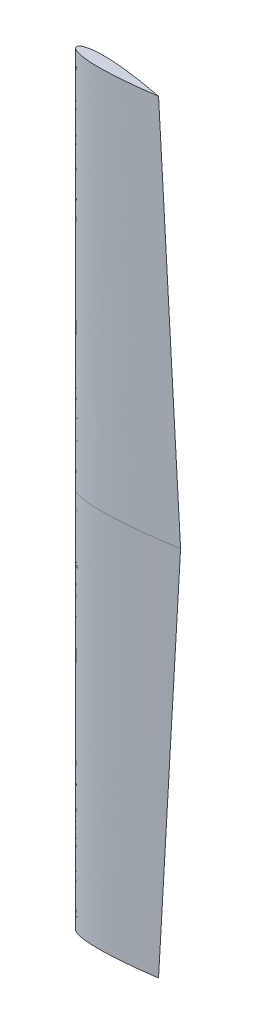
from build123d import *


with BuildPart() as part:
    # rootSketch → Loft1 section 0
    with BuildSketch(Plane(origin=(0, 0, 0), x_dir=(1, 0, 0), z_dir=(0, 1, 0))):
        with BuildLine():
            add(Edge.make_bspline(
                [(0, 0), (-2.2143e-05, 0.059910457), (0.005689744, 0.156769494), (0.027513467, 0.29567475), (0.081753505, 0.475775863), (0.154226641, 0.642768166), (0.260374744, 0.824845427), (0.411608789, 1.025675261), (0.629736848, 1.254056111), (0.953213109, 1.522004149), (1.442954854, 1.840410686), (2.189664226, 2.214679298), (3.347105975, 2.649726987), (5.078340765, 3.112876269), (7.664349596, 3.56751884), (11.004997338, 3.880915972), (14.906922914, 3.999519683), (19.16095578, 3.921267268), (22.876052412, 3.721841247), (26.058363999, 3.479391527), (29.231823055, 3.190656997), (31.8813319, 2.913364131), (34.512004858, 2.609280757), (37.691170775, 2.207437926), (40.823877361, 1.783828111), (44.029795465, 1.310113157), (47.107801011, 0.825131031), (49.834400512, 0.364783807), (51.733296144, 0.034944883), (53.577876917, -0.30582466), (54.525084917, -0.484720093), (55, -0.575979708)],
                knots=[0, 0, 0, 0, 0, 0.00384382, 0.006241333, 0.009008344, 0.012070374, 0.015524345, 0.019765532, 0.025140987, 0.032336865, 0.042479637, 0.057256916, 0.078755308, 0.111733691, 0.157569449, 0.225947504, 0.29432556, 0.362703619, 0.431081679, 0.46527071, 0.499459741, 0.5678378, 0.602026832, 0.636215863, 0.704593921, 0.772971981, 0.807161011, 0.841350041, 0.875539073, 0.909728105, 0.909728105, 0.909728105, 0.909728105, 0.909728105], degree=4))
            add(Edge.make_bspline(
                [(0, 0), (-0.001276808, -0.059896854), (0.002405364, -0.156854269), (0.021315288, -0.296186102), (0.071771677, -0.477383633), (0.140731696, -0.645857075), (0.243043381, -0.830117402), (0.390038394, -1.034070398), (0.603335767, -1.266969289), (0.921129604, -1.541632938), (1.404095737, -1.87022602), (2.142803252, -2.260050449), (3.290880204, -2.719242356), (5.01203584, -3.218546308), (7.5879562, -3.727246451), (10.921307989, -4.110536098), (14.819893959, -4.310829561), (19.07463264, -4.32168405), (22.793090953, -4.200104881), (25.979782091, -4.024353639), (29.158591955, -3.802142346), (31.813326903, -3.580397422), (34.449791151, -3.331473396), (37.636675387, -2.996298122), (40.777566333, -2.638387669), (43.992702063, -2.231916292), (47.080189251, -1.811501415), (49.815831549, -1.408356744), (51.721218347, -1.118357629), (53.572531112, -0.816292807), (54.523277876, -0.657273437), (55, -0.575979708)],
                knots=[0, 0, 0, 0, 0, 0.00384382, 0.006241333, 0.009008344, 0.012070374, 0.015524345, 0.019765532, 0.025140987, 0.032336865, 0.042479637, 0.057256916, 0.078755308, 0.111733691, 0.157569449, 0.225947504, 0.29432556, 0.362703619, 0.431081679, 0.46527071, 0.499459741, 0.5678378, 0.602026832, 0.636215863, 0.704593921, 0.772971981, 0.807161011, 0.841350041, 0.875539073, 0.909728105, 0.909728105, 0.909728105, 0.909728105, 0.909728105], degree=4))
        make_face()
    # tipSketch → Loft1 section 1
    with BuildSketch(Plane(origin=(0, 199.9998, 0), x_dir=(1, 0, 0), z_dir=(0, 1, 0))):
        with BuildLine():
            add(Edge.make_bspline(
                [(0, 0), (-2.291e-05, 0.047985884), (0.004564628, 0.125575864), (0.022128746, 0.236951514), (0.065785663, 0.380736989), (0.124150757, 0.513939064), (0.209320837, 0.658302875), (0.329893352, 0.816315878), (0.502752845, 0.994669279), (0.757200925, 1.202241218), (1.144764494, 1.449976653), (1.737475646, 1.740118052), (2.657425069, 2.074372794), (4.038727338, 2.42585814), (6.106215676, 2.761386439), (8.780217749, 2.974789916), (11.907352867, 3.025081267), (15.317259687, 2.912886911), (18.71871004, 2.680653361), (21.691190062, 2.397355858), (24.229922357, 2.111391584), (26.772523087, 1.793609975), (28.875002701, 1.508658782), (31.000579644, 1.197995109), (33.082675643, 0.876676335), (34.804807169, 0.596414356), (36.831233153, 0.25783157), (39.067254194, -0.143561881), (40.942231342, -0.490726471), (42.865619917, -0.873948149), (43.620346005, -1.027551369), (44, -1.106073509)],
                knots=[0, 0, 0, 0, 0, 0.003845658, 0.006245277, 0.009022611, 0.012044555, 0.015501019, 0.019679599, 0.024953702, 0.03195376, 0.041823539, 0.056555515, 0.077861291, 0.110456483, 0.156156733, 0.224644526, 0.293132328, 0.361620133, 0.43010794, 0.498595745, 0.532839648, 0.567083551, 0.635571356, 0.669815259, 0.704059162, 0.738303064, 0.772546967, 0.841034772, 0.875278677, 0.909522582, 0.909522582, 0.909522582, 0.909522582, 0.909522582], degree=4))
            add(Edge.make_bspline(
                [(0, 0), (-0.002433899, -0.047924125), (-0.001750611, -0.125646603), (0.010195329, -0.237764078), (0.046572703, -0.383561458), (0.098171432, -0.519527807), (0.175980476, -0.667988593), (0.288461448, -0.831860102), (0.452141367, -1.018673442), (0.695838757, -1.23876778), (1.070465519, -1.505663182), (1.647850094, -1.825218487), (2.549843179, -2.205273282), (3.911740661, -2.625717277), (5.959759282, -3.064701331), (8.619661662, -3.412188682), (11.740320218, -3.619537285), (15.151557306, -3.678813078), (18.560379896, -3.617776403), (21.543339637, -3.484186949), (24.093233483, -3.326140733), (26.648589519, -3.136511736), (28.762730788, -2.957558104), (30.901232119, -2.754084977), (32.996842784, -2.537785536), (34.730880754, -2.344404864), (36.771759136, -2.108066115), (39.025123726, -1.819526994), (40.915175744, -1.567007836), (42.855389708, -1.280909532), (43.616880234, -1.165421017), (44, -1.106073509)],
                knots=[0, 0, 0, 0, 0, 0.003845658, 0.006245277, 0.009022611, 0.012044555, 0.015501019, 0.019679599, 0.024953702, 0.03195376, 0.041823539, 0.056555515, 0.077861291, 0.110456483, 0.156156733, 0.224644526, 0.293132328, 0.361620133, 0.43010794, 0.498595745, 0.532839648, 0.567083551, 0.635571356, 0.669815259, 0.704059162, 0.738303064, 0.772546967, 0.841034772, 0.875278677, 0.909522582, 0.909522582, 0.909522582, 0.909522582, 0.909522582], degree=4))
        make_face()
    loft1 = loft()

    # Mirror1: Loft1 across plane
    add(loft1.mirror(Plane.ZX))


solid = part.part
